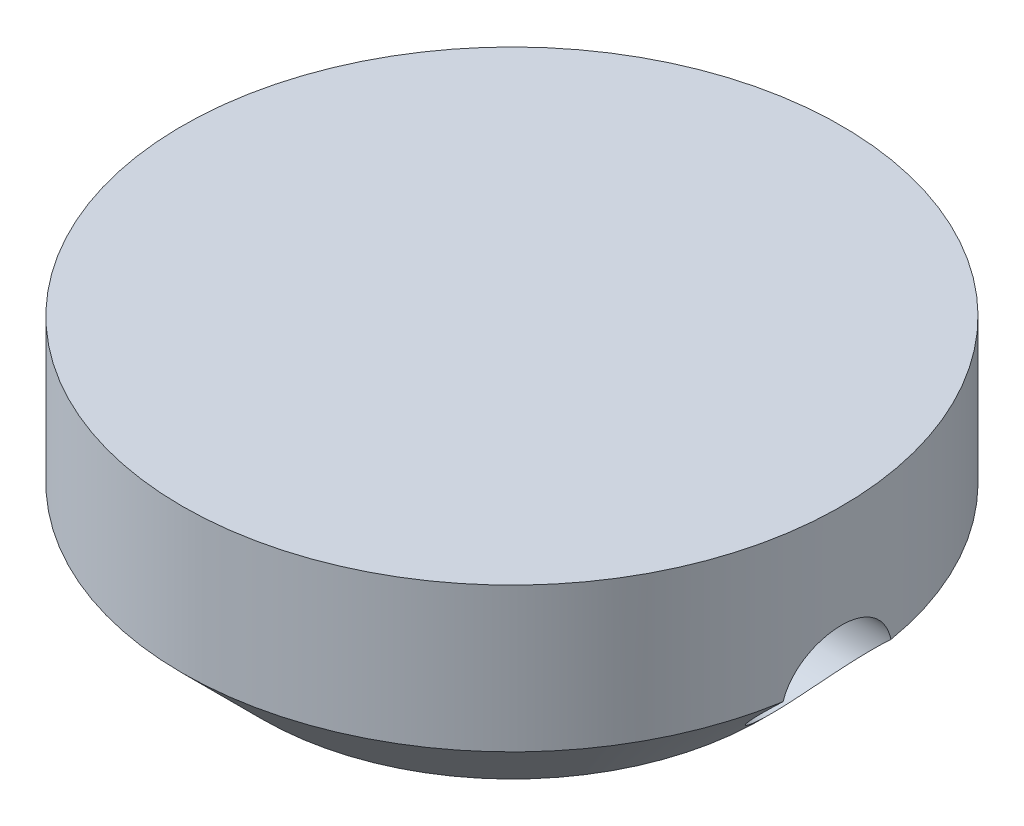
from build123d import *

# Parameters (mm, degrees)
FILLET3_R           = 0.8
FILLET4_R           = 1
SKETCH6_R           = 2.45
BOSS_EXTRUDE2_DEPTH = 2.8
CHAMFER2_SIZE       = 9.05
SKETCH9_R           = 1.95


with BuildPart() as part:
    # Sketch1 → Revolve1 (revolve)
    with BuildSketch(Plane.XY, mode=Mode.PRIVATE) as revolve1_sk:
        Polygon((0, 3.363206456), (-11.5, 3.363206456), (-11.5, -1.676793544), (0, -1.676793544), (0, 0.423206456), (-9.5, 0.423206456), (-9.5, 3.163206456), (0, 3.163206456), align=None)
    revolve(revolve1_sk.sketch.rotate(Axis((0, 2.051889918, 0), (0, -1, 0)), 270), axis=Axis((0, 2.051889918, 0), (0, -1, 0)))

    # Fillet3
    fillet3_edges = [part.edges().sort_by_distance(p)[0] for p in [
        (0, 0.423206456, -9.5),
    ]]
    fillet(fillet3_edges, radius=FILLET3_R)

    # Fillet4
    fillet4_edges = [part.edges().sort_by_distance(p)[0] for p in [
        (0, 3.163206456, -9.5),
    ]]
    fillet(fillet4_edges, radius=FILLET4_R)

    # Sketch6 → Boss-Extrude2 (add)
    with BuildSketch(Plane.XZ.offset(1.676793544)):
        with Locations(Location((0, 0, 0), (0, 0, 270))):
            Circle(SKETCH6_R)
    extrude(amount=BOSS_EXTRUDE2_DEPTH)

    # Chamfer2
    # the kernel refuses this chamfer: 9.05 mm, written as the material it adds along each edge
    with BuildSketch(Plane(origin=(0, -1.676793544, 0), x_dir=(0, 0, -1), z_dir=(-1, 0, 0))) as chamfer2_piece_1_section:
        Polygon((2.45 + CHAMFER2_SIZE, 0), (2.45, CHAMFER2_SIZE), (2.45, 0), align=None)
    chamfer2_piece_1 = revolve(axis=Axis((0, -1.676793544, 0), (0, -1, 0)), mode=Mode.PRIVATE)
    chamfer2_piece_1 = chamfer2_piece_1 & Plane(origin=(0, -3.007193491, 0), x_dir=(0, 0, 1), z_dir=(0, -1, 0)) * Cylinder(11.5, 46, mode=Mode.PRIVATE)
    chamfer2_piece_1 = split(chamfer2_piece_1, bisect_by=Plane(origin=(0, -4.476793544, 10.030399947), z_dir=(0, 1, 0)), keep=Keep.TOP, mode=Mode.PRIVATE)
    add(chamfer2_piece_1)

    # Cut-Sweep1: sweep along a path in Sketch10
    with BuildLine(Plane.XY) as cut_sweep1_path:
        Line((0, 0.423206456), (0, 0.323206456))
        ThreePointArc((0, 0.323206456), (0.732233047, -1.444560497), (2.5, -2.176793544))
        Line((2.5, -2.176793544), (11.5, -2.176793544))
    # Sketch9 → Cut-Sweep1 (sweep, cut)
    with BuildSketch(Plane(origin=(0, 0.423206456, 0), x_dir=(1, 0, 0), z_dir=(0, 1, 0))):
        Circle(SKETCH9_R)
    sweep(path=cut_sweep1_path.line, mode=Mode.SUBTRACT)


solid = part.part
